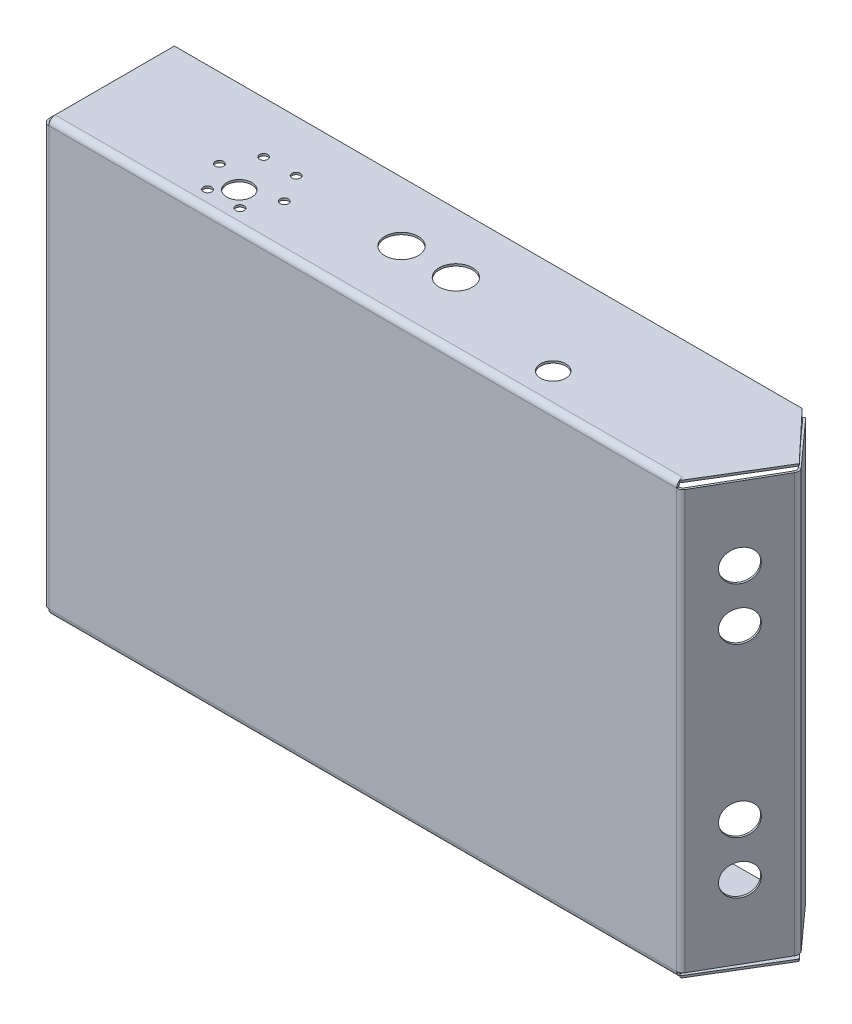
from build123d import *

# Parameters (mm, degrees)
SKETCH1_W           = 300
SKETCH1_H           = 200
BASE_FLANGE1_DEPTH  = 1
EDGE_FLANGE1_DEPTH  = 200
EDGE_FLANGE2_DEPTH  = 300
EDGE_FLANGE3_DEPTH  = 300
EDGE_FLANGE4_DEPTH  = 200
EDGE_FLANGE5_DEPTH  = 200
BOSS_EXTRUDE2_DEPTH = 1
CUT_EXTRUDE4_START  = -100
CUT_EXTRUDE4_DEPTH  = 200
SKETCH26_R          = 7.5
CUT_EXTRUDE5_DEPTH  = 100
EDGE_FLANGE7_DEPTH  = 200
SKETCH38_R          = 6
CUT_EXTRUDE6_DEPTH  = 276.630831386
SKETCH40_R          = 2
CUT_EXTRUDE7_DEPTH  = 276.630831386
SKETCH41_R          = 8
CUT_EXTRUDE8_DEPTH  = 276.630831386


# Read off the part's stored shape, not the designer's step: Cut-Extrude4
# Sheet-metal steps are written as plain solids
with BuildPart() as part:
    # Sketch1 → Base-Flange1 (new body)
    with BuildSketch(Plane.XY):
        Rectangle(SKETCH1_W, SKETCH1_H)
    extrude(amount=-BASE_FLANGE1_DEPTH)

    # Edge-Flange1 section (across the edge) → Edge-Flange1 (add)
    with BuildSketch(Plane(origin=(-152, -100, -1), x_dir=(1, 0, 0), z_dir=(0, 1, 0))):
        with BuildLine():
            Line((-1, 2), (-1, 59))
            Line((-1, 59), (0, 59))
            Line((0, 59), (0, 2))
            ThreePointArc((0, 2), (0.585786438, 0.585786438), (2, 0))
            Line((2, 0), (2, -1))
            ThreePointArc((2, -1), (-0.121320344, -0.121320344), (-1, 2))
        make_face()
    extrude(amount=EDGE_FLANGE1_DEPTH)

    # Edge-Flange2 section (across the edge) → Edge-Flange2 (add)
    with BuildSketch(Plane(origin=(150, -102, -1), x_dir=(0, 1, 0), z_dir=(-1, 0, 0))):
        with BuildLine():
            Line((-1, 2), (-1, 59))
            Line((-1, 59), (0, 59))
            Line((0, 59), (0, 2))
            ThreePointArc((0, 2), (0.585786438, 0.585786438), (2, 0))
            Line((2, 0), (2, -1))
            ThreePointArc((2, -1), (-0.121320344, -0.121320344), (-1, 2))
        make_face()
    extrude(amount=EDGE_FLANGE2_DEPTH)

    # Edge-Flange3 section (across the edge) → Edge-Flange3 (add)
    with BuildSketch(Plane(origin=(-150, 102, -1), x_dir=(0, -1, 0), z_dir=(1, 0, 0))):
        with BuildLine():
            Line((-1, 2), (-1, 59))
            Line((-1, 59), (0, 59))
            Line((0, 59), (0, 2))
            ThreePointArc((0, 2), (0.585786438, 0.585786438), (2, 0))
            Line((2, 0), (2, -1))
            ThreePointArc((2, -1), (-0.121320344, -0.121320344), (-1, 2))
        make_face()
    extrude(amount=EDGE_FLANGE3_DEPTH)

    # Edge-Flange4 section (across the edge) → Edge-Flange4 (add)
    with BuildSketch(Plane(origin=(151.154700538, 100, -1), x_dir=(-0.8660254037844364, 0, -0.5000000000000041), z_dir=(0, -1, 0))):
        with BuildLine():
            Line((-1, 1.154700538), (-1, 39.422649731))
            Line((-1, 39.422649731), (0, 39.422649731))
            Line((0, 39.422649731), (0, 1.154700538))
            ThreePointArc((0, 1.154700538), (0.267949192, 0.154700538), (1, -0.577350269))
            Line((1, -0.577350269), (0.5, -1.443375673))
            ThreePointArc((0.5, -1.443375673), (-0.598076211, -0.345299462), (-1, 1.154700538))
        make_face()
    extrude(amount=EDGE_FLANGE4_DEPTH)

    # Edge-Flange5 section (across the edge) → Edge-Flange5 (add)
    with BuildSketch(Plane(origin=(171.592567932, 100, -36.399424724), x_dir=(-0.7431448254774, 0, 0.6691306063588518), z_dir=(0, -1, 0))):
        with BuildLine():
            Line((-1, 1.453085056), (-1, 32.273457472))
            Line((-1, 32.273457472), (0, 32.273457472))
            Line((0, 32.273457472), (0, 1.453085056))
            ThreePointArc((0, 1.453085056), (0.381966011, 0.277514551), (1.381966011, -0.449027977))
            Line((1.381966011, -0.449027977), (1.072949017, -1.400084493))
            ThreePointArc((1.072949017, -1.400084493), (-0.427050983, -0.310270701), (-1, 1.453085056))
        make_face()
    extrude(amount=EDGE_FLANGE5_DEPTH)

    # Sketch22 → Boss-Extrude2 (add)
    with BuildSketch(Plane(origin=(0, 103, 0), x_dir=(1, 0, 0), z_dir=(0, 1, 0))):
        with BuildLine():
            Line((150, 60), (150, 1.788039282))
            ThreePointArc((150, 1.788039282), (150.365347616, 1.306511779), (150.927474942, 1.528683978))
            Line((150.927474942, 1.528683978), (172.117540282, 36.454601541))
            Line((172.117540282, 36.454601541), (150, 60))
        make_face()
    boss_extrude2 = extrude(amount=-BOSS_EXTRUDE2_DEPTH)

    # Mirror2: Boss-Extrude2 across plane
    add(boss_extrude2.mirror(Plane.ZX))

    # Cut-Extrude4 outline → Cut-Extrude4 (cut)
    with BuildSketch(Plane(origin=(0, 0, 0), x_dir=(1, 0, 0), z_dir=(0, 1, 0)).offset(CUT_EXTRUDE4_START)):
        Polygon((149.997409764, 60.383277644), (150.945002409, 59.330869394), (151.688147235, 60), (150.74055459, 61.052408251), align=None)
    extrude(amount=CUT_EXTRUDE4_DEPTH, mode=Mode.SUBTRACT)

    # Sketch26 → Cut-Extrude5 (cut)
    with BuildSketch(Plane(origin=(113.799038106, 0, 65.701905284), x_dir=(0.500000000000004, 0, -0.8660254037844364), z_dir=(0.8660254037844364, 0, 0.500000000000004))):
        with Locations((96.732050808, 65)):
            Circle(SKETCH26_R)
        with Locations((96.732050808, 40)):
            Circle(SKETCH26_R)
        with Locations(Location((96.732050808, -40, 0), (0, 0, 180))):
            Circle(SKETCH26_R)
        with Locations(Location((96.732050808, -65, 0), (0, 0, 180))):
            Circle(SKETCH26_R)
    extrude(amount=-CUT_EXTRUDE5_DEPTH, mode=Mode.SUBTRACT)

    # Edge-Flange7 section (across the edge) → Edge-Flange7 (add)
    with BuildSketch(Plane(origin=(-152, -100, -61.5), x_dir=(0, 0, 1), z_dir=(0, 1, 0))):
        with BuildLine():
            Line((-1, 1.5), (-1, 9))
            Line((-1, 9), (0, 9))
            Line((0, 9), (0, 1.5))
            ThreePointArc((0, 1.5), (0.439339828, 0.439339828), (1.5, 0))
            Line((1.5, 0), (1.5, -1))
            ThreePointArc((1.5, -1), (-0.267766953, -0.267766953), (-1, 1.5))
        make_face()
    extrude(amount=EDGE_FLANGE7_DEPTH)

    # Sketch38 → Cut-Extrude6 (cut, through all)
    with BuildSketch(Plane.XZ.offset(103)):
        with Locations(Location((-75, -16, 0), (0, 0, 270))):
            Circle(SKETCH38_R)
        with Locations(Location((75, -16, 0), (0, 0, 270))):
            Circle(SKETCH38_R)
    extrude(amount=-CUT_EXTRUDE6_DEPTH, mode=Mode.SUBTRACT)

    # Sketch40 → Cut-Extrude7 (cut, through all)
    with BuildSketch(Plane.XZ.offset(103)):
        with Locations(Location((-90.5, -22, 0), (0, 0, 270))):
            Circle(SKETCH40_R)
        with Locations(Location((-82.75, -8.576606241, 0), (0, 0, 270))):
            Circle(SKETCH40_R)
        with Locations(Location((-67.25, -8.576606241, 0), (0, 0, 270))):
            Circle(SKETCH40_R)
        with Locations(Location((-59.5, -22, 0), (0, 0, 270))):
            Circle(SKETCH40_R)
        with Locations(Location((-67.25, -35.423393759, 0), (0, 0, 270))):
            Circle(SKETCH40_R)
        with Locations(Location((-82.75, -35.423393759, 0), (0, 0, 270))):
            Circle(SKETCH40_R)
    extrude(amount=-CUT_EXTRUDE7_DEPTH, mode=Mode.SUBTRACT)

    # Sketch41 → Cut-Extrude8 (cut, through all)
    with BuildSketch(Plane.XZ.offset(103)):
        with Locations(Location((-13, -31.5, 0), (0, 0, 270))):
            Circle(SKETCH41_R)
        with Locations(Location((13, -31.5, 0), (0, 0, 270))):
            Circle(SKETCH41_R)
    extrude(amount=-CUT_EXTRUDE8_DEPTH, mode=Mode.SUBTRACT)


solid = part.part
